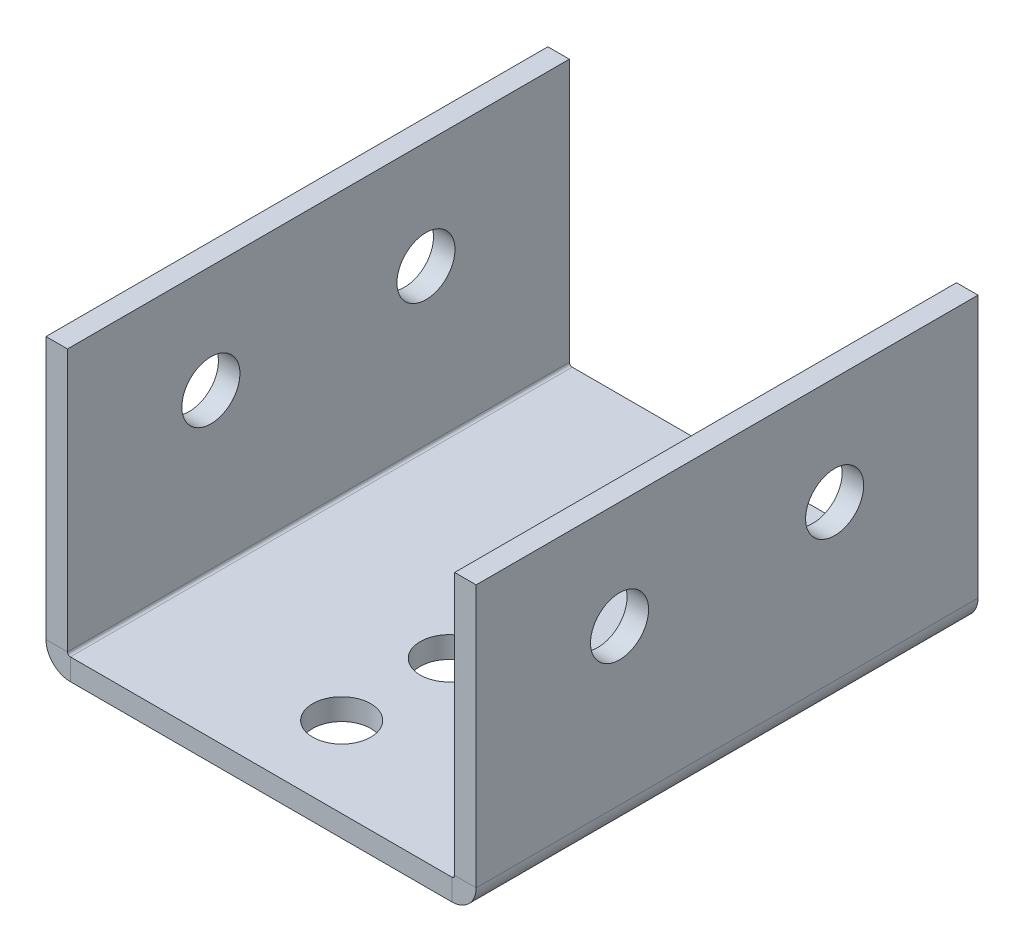
from build123d import *

# Parameters (mm, degrees)
SKETCH1_W                      = 60
SKETCH1_H                      = 70
BASE_FLANGE1_DEPTH             = 3
EDGE_FLANGE1_STRIP_W           = 12.8
EDGE_FLANGE1_STRIP_H           = 3
EDGE_FLANGE1_STRIP_CUT_DEPTH   = 70
EDGE_FLANGE1_STRIP_2_W         = 12.8
EDGE_FLANGE1_STRIP_2_H         = 3
EDGE_FLANGE1_STRIP_CUT_2_DEPTH = 70
EDGE_FLANGE1_DEPTH             = 70
EDGE_FLANGE1_BEND_DEPTH        = 70
CUT_EXTRUDE1_REACH             = 80.702
SKETCH14_R                     = 4.05
SKETCH15_R                     = 4.05
CUT_EXTRUDE2_DEPTH             = 3


# Sheet-metal steps are written as plain solids
with BuildPart() as part:
    # Sketch1 → Base-Flange1 (new body)
    with BuildSketch(Plane(origin=(0, 0, 0), x_dir=(1, 0, 0), z_dir=(0, 1, 0))):
        Rectangle(SKETCH1_W, SKETCH1_H)
    extrude(amount=-BASE_FLANGE1_DEPTH)

    # Edge-Flange1 strip (across the edge) → Edge-Flange1 strip cut (cut)
    with BuildSketch(Plane(origin=(30, 0, 35), x_dir=(-1, 0, 0), z_dir=(0, 0, -1))):
        with Locations((-3, -1.5)):
            Rectangle(EDGE_FLANGE1_STRIP_W, EDGE_FLANGE1_STRIP_H)
    extrude(amount=EDGE_FLANGE1_STRIP_CUT_DEPTH, mode=Mode.SUBTRACT)

    # Edge-Flange1 strip 2 (across the edge) → Edge-Flange1 strip cut 2 (cut)
    with BuildSketch(Plane(origin=(-30, 0, -35), x_dir=(1, 0, 0), z_dir=(0, 0, 1))):
        with Locations((-3, -1.5)):
            Rectangle(EDGE_FLANGE1_STRIP_2_W, EDGE_FLANGE1_STRIP_2_H)
    extrude(amount=EDGE_FLANGE1_STRIP_CUT_2_DEPTH, mode=Mode.SUBTRACT)

    # Edge-Flange1 section (across the edge) → Edge-Flange1 (add)
    with BuildSketch(Plane(origin=(30, 0, 35), x_dir=(-1, 0, 0), z_dir=(0, 0, -1))):
        with BuildLine():
            Line((0, 0.4), (0, 37))
            Line((0, 37), (3, 37))
            Line((3, 37), (3, 0.4))
            ThreePointArc((3, 0.4), (3.117157288, 0.117157288), (3.4, 0))
            Line((3.4, 0), (3.4, -3))
            ThreePointArc((3.4, -3), (0.995836944, -2.004163056), (0, 0.4))
        make_face()
    extrude(amount=EDGE_FLANGE1_DEPTH)

    # Edge-Flange1 section 2 (across the edge) → Edge-Flange1 bend (add)
    with BuildSketch(Plane(origin=(-30, 0, -35), x_dir=(1, 0, 0), z_dir=(0, 0, 1))):
        with BuildLine():
            Line((0, 0.4), (0, 37))
            Line((0, 37), (3, 37))
            Line((3, 37), (3, 0.4))
            ThreePointArc((3, 0.4), (3.117157288, 0.117157288), (3.4, 0))
            Line((3.4, 0), (3.4, -3))
            ThreePointArc((3.4, -3), (0.995836944, -2.004163056), (0, 0.4))
        make_face()
    extrude(amount=EDGE_FLANGE1_BEND_DEPTH)

    # Cut-Extrude1: up to this face of the body (flat: up to its plane)
    cut_extrude1_end = Plane(part.part.faces().sort_by_distance((-30, 18.7, 0))[0])
    # Sketch14 → Cut-Extrude1 (cut, up to the picked face)
    with BuildSketch(Plane(origin=(30, 0, 0), x_dir=(0, 0, -1), z_dir=(1, 0, 0)), mode=Mode.PRIVATE) as cut_extrude1_sk1:
        with Locations(Location((-15, 22, 0), (0, 0, 90))):
            Circle(SKETCH14_R)
    cut_extrude1_tool1 = split(extrude(cut_extrude1_sk1.sketch, amount=-CUT_EXTRUDE1_REACH, mode=Mode.PRIVATE), bisect_by=cut_extrude1_end, keep=Keep.BOTH, mode=Mode.PRIVATE)
    # Sketch14 → Cut-Extrude1 (cut, up to the picked face)
    with BuildSketch(Plane(origin=(30, 0, 0), x_dir=(0, 0, -1), z_dir=(1, 0, 0)), mode=Mode.PRIVATE) as cut_extrude1_sk2:
        with Locations(Location((15, 22, 0), (0, 0, 90))):
            Circle(SKETCH14_R)
    cut_extrude1_tool2 = split(extrude(cut_extrude1_sk2.sketch, amount=-CUT_EXTRUDE1_REACH, mode=Mode.PRIVATE), bisect_by=cut_extrude1_end, keep=Keep.BOTH, mode=Mode.PRIVATE)
    add(cut_extrude1_tool1.solids().sort_by(Axis((30, 22, 15), (-1, 0, 0)))[0], mode=Mode.SUBTRACT)
    add(cut_extrude1_tool2.solids().sort_by(Axis((30, 22, -15), (-1, 0, 0)))[0], mode=Mode.SUBTRACT)

    # Sketch15 → Cut-Extrude2 (cut)
    with BuildSketch(Plane.XZ.offset(3)):
        with Locations(Location((0, 8.75, 0), (0, 0, 270))):
            Circle(SKETCH15_R)
        with Locations(Location((0, 23.75, 0), (0, 0, 270))):
            Circle(SKETCH15_R)
    extrude(amount=-CUT_EXTRUDE2_DEPTH, mode=Mode.SUBTRACT)


solid = part.part
